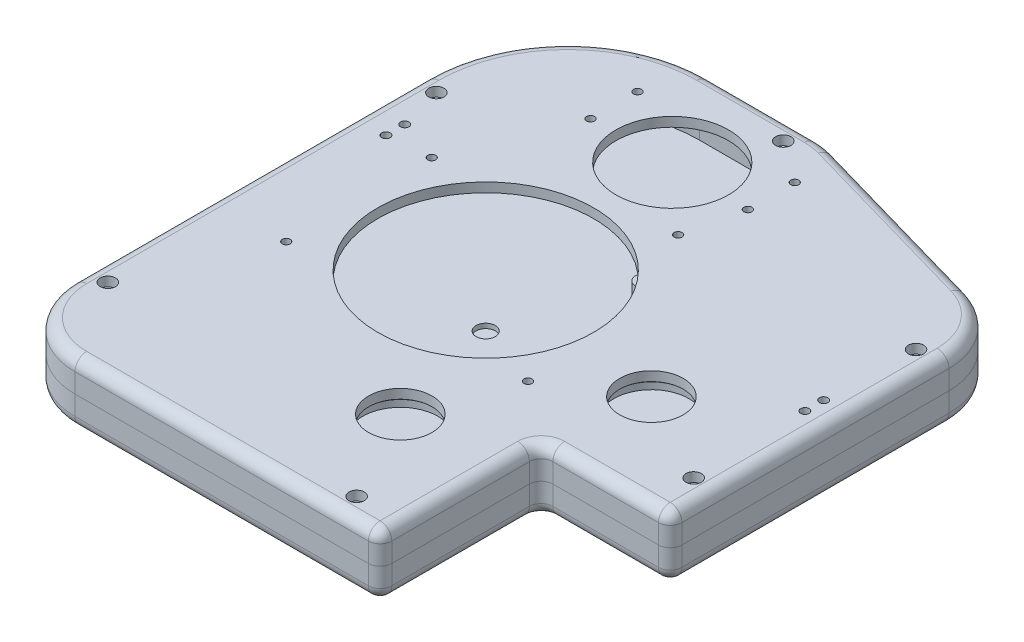
from build123d import *

# Parameters (mm, degrees)
BOSS_EXTRUDE1_DEPTH        = 26.5
FILLET2_R                  = 60
FILLET3_R                  = 30
FILLET4_R                  = 30
FILLET5_R                  = 30
FILLET9_R                  = 5
SHELL1_T                   = 4
FILLET6_R                  = 5
CUT_EXTRUDE1_REACH         = 267.334
SKETCH2_R                  = 46
SKETCH2_R_2                = 24
SKETCH3_R                  = 4.1
CUT_EXTRUDE2_DEPTH         = 2
SKETCH4_R                  = 4.25
CUT_EXTRUDE3_DEPTH         = 2
SKETCH9_R                  = 18.05
SKETCH9_R_2                = 14.5
BOSS_EXTRUDE5_DEPTH        = 0.8
SKETCH10_R                 = 18.05
SKETCH10_R_2               = 16.05
BOSS_EXTRUDE6_DEPTH        = 4
SKETCH11_R                 = 16.25
CUT_EXTRUDE4_DEPTH         = 2
CUT_EXTRUDE5_REACH         = 266.965
SKETCH13_R                 = 13.5
BRIDGE_HOLES_REACH         = 267.334
SKETCH14_R                 = 1.7
BOSS_EXTRUDE8_REACH        = 266.965
CUT_EXTRUDE7_DEPTH         = 266.334223198
CUT_EXTRUDE7_DEPTH_BACK    = 266.334223198
SKETCH16_R                 = 1.8
SKETCH18_R                 = 3.25
CUT_EXTRUDE9_DEPTH         = 4
SKETCH19_R                 = 3.8
SKETCH19_R_2               = 1.8
OUTPUT_TENSIONER_DEPTH     = 3
OUTPUT_TENSIONER_CUT_REACH = 266.965
SKETCH20_R                 = 1.8
SKETCH22_R                 = 3.8
SKETCH22_R_2               = 1.8
MOTOR_TENSIONER_DEPTH      = 9.25
SKETCH23_R                 = 1.8
MOTOR_TENSIONER_CUT_DEPTH  = 4
NUT_HOLES_DEPTH            = 2.2
CUT_EXTRUDE10_DEPTH        = 266.334223198
CUT_EXTRUDE10_DEPTH_BACK   = 266.334223198
SKETCH25_R                 = 1.8


with BuildPart() as part:
    # Sketch1 → Boss-Extrude1 (new body)
    with BuildSketch(Plane(origin=(0, 0, 0), x_dir=(1, 0, 0), z_dir=(0, 1, 0))):
        Polygon((0, 240), (-110, 240), (-110, 0), (0, 0), (50, 0), (50, 68.62), (105, 68.62), (105, 210), align=None)
    extrude(amount=BOSS_EXTRUDE1_DEPTH)

    # Fillet2
    fillet2_edges = [part.edges().sort_by_distance(p)[0] for p in [
        (-110, 13.25, -240),
    ]]
    fillet(fillet2_edges, radius=FILLET2_R)

    # Fillet3
    fillet3_edges = [part.edges().sort_by_distance(p)[0] for p in [
        (105, 13.25, -210),
    ]]
    fillet(fillet3_edges, radius=FILLET3_R)

    # Fillet4
    fillet4_edges = [part.edges().sort_by_distance(p)[0] for p in [
        (-110, 13.25, 0),
    ]]
    fillet(fillet4_edges, radius=FILLET4_R)

    # Fillet5
    fillet5_edges = [part.edges().sort_by_distance(p)[0] for p in [
        (0, 13.25, -240),
    ]]
    fillet(fillet5_edges, radius=FILLET5_R)

    # Fillet9
    fillet9_edges = [part.edges().sort_by_distance(p)[0] for p in [
        (105, 13.25, -68.62),
        (50, 13.25, -68.62),
        (50, 13.25, 0),
    ]]
    fillet(fillet9_edges, radius=FILLET9_R)

    # Shell1 (no face opened: a closed hollow body)
    add(offset(amount=-SHELL1_T, mode=Mode.PRIVATE), mode=Mode.SUBTRACT)

    # Fillet6
    fillet6_edges = [part.edges().sort_by_distance(p)[0] for p in [
        (-110, 0, -105),
        (-110, 26.5, -105),
        (-92.426406871, 0, -222.426406871),
        (-92.426406871, 26.5, -222.426406871),
        (43.640809667, 0, -227.531197238),
        (43.640809667, 26.5, -227.531197238),
        (98.950459443, 0, -205.436823012),
        (98.950459443, 26.5, -205.436823012),
        (-17.5, 0, 0),
        (-17.5, 26.5, 0),
        (-101.213203436, 0, -8.786796564),
        (-101.213203436, 26.5, -8.786796564),
        (-27.10082417, 0, -240),
        (-27.10082417, 26.5, -240),
        (-0.040611983, 0, -239.710028213),
        (-0.040611983, 26.5, -239.710028213),
        (50, 0, -34.31),
        (50, 26.5, -34.31),
        (105, 0, -130.495478809),
        (77.5, 0, -68.62),
        (103.535533906, 0, -70.084466094),
        (48.535533906, 0, -1.464466094),
        (77.5, 26.5, -68.62),
        (105, 26.5, -130.495478809),
        (103.535533906, 26.5, -70.084466094),
        (48.535533906, 26.5, -1.464466094),
        (51.464466094, 0, -67.155533906),
        (51.464466094, 26.5, -67.155533906),
    ]]
    fillet(fillet6_edges, radius=FILLET6_R)

    # Sketch2 → Cut-Extrude1 (cut, up to next)
    with BuildSketch(Plane(origin=(0, 26.5, 0), x_dir=(1, 0, 0), z_dir=(0, 1, 0)), mode=Mode.PRIVATE) as cut_extrude1_sk1:
        with Locations(Location((-25, 120, 0), (0, 0, 270))):
            Circle(SKETCH2_R)
    cut_extrude1_tool1 = extrude(cut_extrude1_sk1.sketch, amount=-CUT_EXTRUDE1_REACH, mode=Mode.PRIVATE) & part.part
    # Sketch2 → Cut-Extrude1 (cut, up to next)
    with BuildSketch(Plane(origin=(0, 26.5, 0), x_dir=(1, 0, 0), z_dir=(0, 1, 0)), mode=Mode.PRIVATE) as cut_extrude1_sk2:
        with Locations(Location((-25, 199.5, 0), (0, 0, 270))):
            Circle(SKETCH2_R_2)
    cut_extrude1_tool2 = extrude(cut_extrude1_sk2.sketch, amount=-CUT_EXTRUDE1_REACH, mode=Mode.PRIVATE) & part.part
    add(cut_extrude1_tool1.solids().sort_by_distance((-25, 26.5, -120))[0], mode=Mode.SUBTRACT)
    add(cut_extrude1_tool2.solids().sort_by_distance((-25, 26.5, -199.5))[0], mode=Mode.SUBTRACT)

    # Sketch3 → Cut-Extrude2 (cut)
    with BuildSketch(Plane(origin=(0, 4, 0), x_dir=(1, 0, 0), z_dir=(0, 1, 0))):
        with Locations(Location((-60, 48.62, 0), (0, 0, 270))):
            Circle(SKETCH3_R)
        with Locations(Location((41.22, 176.82, 0), (0, 0, 270))):
            Circle(SKETCH3_R)
        with Locations(Location((-25, 120, 0), (0, 0, 270))):
            Circle(SKETCH3_R)
        with Locations(Location((-25, 199.5, 0), (0, 0, 270))):
            Circle(SKETCH3_R)
    extrude(amount=-CUT_EXTRUDE2_DEPTH, mode=Mode.SUBTRACT)

    # Sketch4 → Cut-Extrude3 (cut)
    with BuildSketch(Plane.XZ.offset(-22.5)):
        with Locations(Location((-60, -48.62, 0), (0, 0, 270))):
            Circle(SKETCH4_R)
        with Locations(Location((41.22, -176.82, 0), (0, 0, 270))):
            Circle(SKETCH4_R)
    extrude(amount=-CUT_EXTRUDE3_DEPTH, mode=Mode.SUBTRACT)

    # Sketch9 → Boss-Extrude5 (add)
    # profile 1 of 2: a face of its own
    with BuildSketch(Plane.XZ.offset(-22.5)):
        with Locations(Location((57, -108.62, 0), (0, 0, 90))):
            Circle(SKETCH9_R)
        with Locations(Location((57, -108.62, 0), (0, 0, 270))):
            Circle(SKETCH9_R_2, mode=Mode.SUBTRACT)
    # profile 2 of 2: a face of its own
    with BuildSketch(Plane.XZ.offset(-22.5)):
        with Locations(Location((10, -48.62, 0), (0, 0, 90))):
            Circle(SKETCH9_R)
        with Locations(Location((10, -48.62, 0), (0, 0, 270))):
            Circle(SKETCH9_R_2, mode=Mode.SUBTRACT)
    extrude(amount=BOSS_EXTRUDE5_DEPTH)

    # Sketch10 → Boss-Extrude6 (add)
    # profile 1 of 2: a face of its own
    with BuildSketch(Plane.XZ.offset(-21.7)):
        with Locations(Location((10, -48.62, 0), (0, 0, 90))):
            Circle(SKETCH10_R)
        with Locations(Location((10, -48.62, 0), (0, 0, 270))):
            Circle(SKETCH10_R_2, mode=Mode.SUBTRACT)
    # profile 2 of 2: a face of its own
    with BuildSketch(Plane.XZ.offset(-21.7)):
        with Locations(Location((57, -108.62, 0), (0, 0, 90))):
            Circle(SKETCH10_R)
        with Locations(Location((57, -108.62, 0), (0, 0, 270))):
            Circle(SKETCH10_R_2, mode=Mode.SUBTRACT)
    extrude(amount=BOSS_EXTRUDE6_DEPTH)

    # Sketch11 → Cut-Extrude4 (cut)
    with BuildSketch(Plane(origin=(0, 4, 0), x_dir=(1, 0, 0), z_dir=(0, 1, 0))):
        with Locations(Location((10, 48.62, 0), (0, 0, 270))):
            Circle(SKETCH11_R)
        with Locations(Location((57, 108.62, 0), (0, 0, 270))):
            Circle(SKETCH11_R)
    extrude(amount=-CUT_EXTRUDE4_DEPTH, mode=Mode.SUBTRACT)

    # Sketch13 → Cut-Extrude5 (cut, up to next)
    with BuildSketch(Plane.XZ.offset(-22.5), mode=Mode.PRIVATE) as cut_extrude5_sk1:
        with Locations(Location((57, -108.62, 0), (0, 0, 270))):
            Circle(SKETCH13_R)
    cut_extrude5_tool1 = extrude(cut_extrude5_sk1.sketch, amount=-CUT_EXTRUDE5_REACH, mode=Mode.PRIVATE) & part.part
    # Sketch13 → Cut-Extrude5 (cut, up to next)
    with BuildSketch(Plane.XZ.offset(-22.5), mode=Mode.PRIVATE) as cut_extrude5_sk2:
        with Locations(Location((10, -48.62, 0), (0, 0, 270))):
            Circle(SKETCH13_R)
    cut_extrude5_tool2 = extrude(cut_extrude5_sk2.sketch, amount=-CUT_EXTRUDE5_REACH, mode=Mode.PRIVATE) & part.part
    add(cut_extrude5_tool1.solids().sort_by_distance((57, 22.5, -108.62))[0], mode=Mode.SUBTRACT)
    add(cut_extrude5_tool2.solids().sort_by_distance((10, 22.5, -48.62))[0], mode=Mode.SUBTRACT)

    # Sketch14 → Bridge Holes (cut, up to next)
    with BuildSketch(Plane(origin=(0, 26.5, 0), x_dir=(1, 0, 0), z_dir=(0, 1, 0)), mode=Mode.PRIVATE) as bridge_holes_sk1:
        with Locations(Location((-58.5, 218.19, 0), (0, 0, 270))):
            Circle(SKETCH14_R)
    bridge_holes_tool1 = extrude(bridge_holes_sk1.sketch, amount=-BRIDGE_HOLES_REACH, mode=Mode.PRIVATE) & part.part
    # Sketch14 → Bridge Holes (cut, up to next)
    with BuildSketch(Plane(origin=(0, 26.5, 0), x_dir=(1, 0, 0), z_dir=(0, 1, 0)), mode=Mode.PRIVATE) as bridge_holes_sk2:
        with Locations(Location((-58.5, 198.19, 0), (0, 0, 270))):
            Circle(SKETCH14_R)
    bridge_holes_tool2 = extrude(bridge_holes_sk2.sketch, amount=-BRIDGE_HOLES_REACH, mode=Mode.PRIVATE) & part.part
    # Sketch14 → Bridge Holes (cut, up to next)
    with BuildSketch(Plane(origin=(0, 26.5, 0), x_dir=(1, 0, 0), z_dir=(0, 1, 0)), mode=Mode.PRIVATE) as bridge_holes_sk3:
        with Locations(Location((8.5, 218.19, 0), (0, 0, 270))):
            Circle(SKETCH14_R)
    bridge_holes_tool3 = extrude(bridge_holes_sk3.sketch, amount=-BRIDGE_HOLES_REACH, mode=Mode.PRIVATE) & part.part
    # Sketch14 → Bridge Holes (cut, up to next)
    with BuildSketch(Plane(origin=(0, 26.5, 0), x_dir=(1, 0, 0), z_dir=(0, 1, 0)), mode=Mode.PRIVATE) as bridge_holes_sk4:
        with Locations(Location((8.5, 198.19, 0), (0, 0, 270))):
            Circle(SKETCH14_R)
    bridge_holes_tool4 = extrude(bridge_holes_sk4.sketch, amount=-BRIDGE_HOLES_REACH, mode=Mode.PRIVATE) & part.part
    # Sketch14 → Bridge Holes (cut, up to next)
    with BuildSketch(Plane(origin=(0, 26.5, 0), x_dir=(1, 0, 0), z_dir=(0, 1, 0)), mode=Mode.PRIVATE) as bridge_holes_sk5:
        with Locations(Location((-78, 150, 0), (0, 0, 270))):
            Circle(SKETCH14_R)
    bridge_holes_tool5 = extrude(bridge_holes_sk5.sketch, amount=-BRIDGE_HOLES_REACH, mode=Mode.PRIVATE) & part.part
    # Sketch14 → Bridge Holes (cut, up to next)
    with BuildSketch(Plane(origin=(0, 26.5, 0), x_dir=(1, 0, 0), z_dir=(0, 1, 0)), mode=Mode.PRIVATE) as bridge_holes_sk6:
        with Locations(Location((-78, 88, 0), (0, 0, 270))):
            Circle(SKETCH14_R)
    bridge_holes_tool6 = extrude(bridge_holes_sk6.sketch, amount=-BRIDGE_HOLES_REACH, mode=Mode.PRIVATE) & part.part
    # Sketch14 → Bridge Holes (cut, up to next)
    with BuildSketch(Plane(origin=(0, 26.5, 0), x_dir=(1, 0, 0), z_dir=(0, 1, 0)), mode=Mode.PRIVATE) as bridge_holes_sk7:
        with Locations(Location((3, 174, 0), (0, 0, 270))):
            Circle(SKETCH14_R)
    bridge_holes_tool7 = extrude(bridge_holes_sk7.sketch, amount=-BRIDGE_HOLES_REACH, mode=Mode.PRIVATE) & part.part
    # Sketch14 → Bridge Holes (cut, up to next)
    with BuildSketch(Plane(origin=(0, 26.5, 0), x_dir=(1, 0, 0), z_dir=(0, 1, 0)), mode=Mode.PRIVATE) as bridge_holes_sk8:
        with Locations(Location((25, 88, 0), (0, 0, 270))):
            Circle(SKETCH14_R)
    bridge_holes_tool8 = extrude(bridge_holes_sk8.sketch, amount=-BRIDGE_HOLES_REACH, mode=Mode.PRIVATE) & part.part
    add(bridge_holes_tool1.solids().sort_by_distance((-58.5, 26.5, -218.19))[0], mode=Mode.SUBTRACT)
    add(bridge_holes_tool2.solids().sort_by_distance((-58.5, 26.5, -198.19))[0], mode=Mode.SUBTRACT)
    add(bridge_holes_tool3.solids().sort_by_distance((8.5, 26.5, -218.19))[0], mode=Mode.SUBTRACT)
    add(bridge_holes_tool4.solids().sort_by_distance((8.5, 26.5, -198.19))[0], mode=Mode.SUBTRACT)
    add(bridge_holes_tool5.solids().sort_by_distance((-78, 26.5, -150))[0], mode=Mode.SUBTRACT)
    add(bridge_holes_tool6.solids().sort_by_distance((-78, 26.5, -88))[0], mode=Mode.SUBTRACT)
    add(bridge_holes_tool7.solids().sort_by_distance((3, 26.5, -174))[0], mode=Mode.SUBTRACT)
    add(bridge_holes_tool8.solids().sort_by_distance((25, 26.5, -88))[0], mode=Mode.SUBTRACT)

    # Sketch15 → Boss-Extrude8 (add, up to next)
    with BuildSketch(Plane(origin=(0, 4, 0), x_dir=(1, 0, 0), z_dir=(0, 1, 0)), mode=Mode.PRIVATE) as boss_extrude8_sk1:
        with BuildLine():
            Line((-106, 30), (-101, 30))
            ThreePointArc((-101, 30), (-96, 35), (-101, 40))
            Line((-101, 40), (-106, 40))
            Line((-106, 40), (-106, 30))
        make_face()
    boss_extrude8_tool1 = extrude(boss_extrude8_sk1.sketch, amount=BOSS_EXTRUDE8_REACH, mode=Mode.PRIVATE) - part.part
    # Sketch15 → Boss-Extrude8 (add, up to next)
    with BuildSketch(Plane(origin=(0, 4, 0), x_dir=(1, 0, 0), z_dir=(0, 1, 0)), mode=Mode.PRIVATE) as boss_extrude8_sk2:
        with BuildLine():
            Line((-106, 180), (-101, 180))
            ThreePointArc((-101, 180), (-96, 175), (-101, 170))
            Line((-101, 170), (-106, 170))
            Line((-106, 170), (-106, 180))
        make_face()
    boss_extrude8_tool2 = extrude(boss_extrude8_sk2.sketch, amount=BOSS_EXTRUDE8_REACH, mode=Mode.PRIVATE) - part.part
    # Sketch15 → Boss-Extrude8 (add, up to next)
    with BuildSketch(Plane(origin=(0, 4, 0), x_dir=(1, 0, 0), z_dir=(0, 1, 0)), mode=Mode.PRIVATE) as boss_extrude8_sk3:
        with BuildLine():
            Line((-4.201648339, 236), (-14.201648339, 236))
            Line((-14.201648339, 236), (-14.201648339, 231))
            ThreePointArc((-14.201648339, 231), (-9.201648339, 226), (-4.201648339, 231))
            Line((-4.201648339, 231), (-4.201648339, 236))
        make_face()
    boss_extrude8_tool3 = extrude(boss_extrude8_sk3.sketch, amount=BOSS_EXTRUDE8_REACH, mode=Mode.PRIVATE) - part.part
    # Sketch15 → Boss-Extrude8 (add, up to next)
    with BuildSketch(Plane(origin=(0, 4, 0), x_dir=(1, 0, 0), z_dir=(0, 1, 0)), mode=Mode.PRIVATE) as boss_extrude8_sk4:
        with BuildLine():
            Line((101, 187.370957617), (96, 187.370957617))
            ThreePointArc((96, 187.370957617), (91, 182.370957617), (96, 177.370957617))
            Line((96, 177.370957617), (101, 177.370957617))
            Line((101, 177.370957617), (101, 187.370957617))
        make_face()
    boss_extrude8_tool4 = extrude(boss_extrude8_sk4.sketch, amount=BOSS_EXTRUDE8_REACH, mode=Mode.PRIVATE) - part.part
    # Sketch15 → Boss-Extrude8 (add, up to next)
    with BuildSketch(Plane(origin=(0, 4, 0), x_dir=(1, 0, 0), z_dir=(0, 1, 0)), mode=Mode.PRIVATE) as boss_extrude8_sk5:
        with BuildLine():
            Line((101, 82.62), (96, 82.62))
            ThreePointArc((96, 82.62), (91, 87.62), (96, 92.62))
            Line((96, 92.62), (101, 92.62))
            Line((101, 92.62), (101, 82.62))
        make_face()
    boss_extrude8_tool5 = extrude(boss_extrude8_sk5.sketch, amount=BOSS_EXTRUDE8_REACH, mode=Mode.PRIVATE) - part.part
    # Sketch15 → Boss-Extrude8 (add, up to next)
    with BuildSketch(Plane(origin=(0, 4, 0), x_dir=(1, 0, 0), z_dir=(0, 1, 0)), mode=Mode.PRIVATE) as boss_extrude8_sk6:
        with BuildLine():
            Line((36, 4), (26, 4))
            Line((26, 4), (26, 9))
            ThreePointArc((26, 9), (31, 14), (36, 9))
            Line((36, 9), (36, 4))
        make_face()
    boss_extrude8_tool6 = extrude(boss_extrude8_sk6.sketch, amount=BOSS_EXTRUDE8_REACH, mode=Mode.PRIVATE) - part.part
    add(boss_extrude8_tool1.solids().sort_by_distance((-101.466749, 4, -35))[0])
    add(boss_extrude8_tool2.solids().sort_by_distance((-101.466749, 4, -175))[0])
    add(boss_extrude8_tool3.solids().sort_by_distance((-9.201648, 4, -231.466749))[0])
    add(boss_extrude8_tool4.solids().sort_by_distance((96.466749, 4, -182.370958))[0])
    add(boss_extrude8_tool5.solids().sort_by_distance((96.466749, 4, -87.62))[0])
    add(boss_extrude8_tool6.solids().sort_by_distance((31, 4, -8.533251))[0])

    # Sketch16 → Cut-Extrude7 (cut, two sides: drawn at the far end of the back side and taken through both)
    with BuildSketch(Plane(origin=(0, 26.5, 0), x_dir=(1, 0, 0), z_dir=(0, 1, 0)).offset(-CUT_EXTRUDE7_DEPTH_BACK)):
        with Locations(Location((-101, 35, 0), (0, 0, 270))):
            Circle(SKETCH16_R)
        with Locations(Location((-101, 175, 0), (0, 0, 270))):
            Circle(SKETCH16_R)
        with Locations(Location((-9.201648339, 231, 0), (0, 0, 270))):
            Circle(SKETCH16_R)
        with Locations(Location((96, 182.370957617, 0), (0, 0, 270))):
            Circle(SKETCH16_R)
        with Locations(Location((96, 87.62, 0), (0, 0, 270))):
            Circle(SKETCH16_R)
        with Locations(Location((31, 9, 0), (0, 0, 270))):
            Circle(SKETCH16_R)
    extrude(amount=CUT_EXTRUDE7_DEPTH + CUT_EXTRUDE7_DEPTH_BACK, mode=Mode.SUBTRACT)

    # Sketch18 → Cut-Extrude9 (cut)
    with BuildSketch(Plane(origin=(0, 26.5, 0), x_dir=(1, 0, 0), z_dir=(0, 1, 0))):
        with Locations(Location((96, 182.370957617, 0), (0, 0, 270))):
            Circle(SKETCH18_R)
        with Locations(Location((96, 87.62, 0), (0, 0, 270))):
            Circle(SKETCH18_R)
        with Locations(Location((31, 9, 0), (0, 0, 270))):
            Circle(SKETCH18_R)
        with Locations(Location((-101, 35, 0), (0, 0, 270))):
            Circle(SKETCH18_R)
        with Locations(Location((-101, 175, 0), (0, 0, 270))):
            Circle(SKETCH18_R)
        with Locations(Location((-9.201648339, 231, 0), (0, 0, 270))):
            Circle(SKETCH18_R)
    extrude(amount=-CUT_EXTRUDE9_DEPTH, mode=Mode.SUBTRACT)

    # Sketch19 → Output Tensioner (add)
    # profile 1 of 4: a face of its own
    with BuildSketch(Plane(origin=(0, 4, 0), x_dir=(1, 0, 0), z_dir=(0, 1, 0))):
        with Locations(Location((74.440986501, 148.580130003, 0), (0, 0, 270))):
            Circle(SKETCH19_R)
        with Locations(Location((74.440986501, 148.580130003, 0), (0, 0, 270))):
            Circle(SKETCH19_R_2, mode=Mode.SUBTRACT)
    # profile 2 of 4: a face of its own
    with BuildSketch(Plane(origin=(0, 4, 0), x_dir=(1, 0, 0), z_dir=(0, 1, 0))):
        with Locations(Location((23.779413458, 136.858141401, 0), (0, 0, 270))):
            Circle(SKETCH19_R)
        with Locations(Location((23.779413458, 136.858141401, 0), (0, 0, 270))):
            Circle(SKETCH19_R_2, mode=Mode.SUBTRACT)
    # profile 3 of 4: a face of its own
    with BuildSketch(Plane(origin=(0, 4, 0), x_dir=(1, 0, 0), z_dir=(0, 1, 0))):
        with Locations(Location((-25, 74.62, 0), (0, 0, 270))):
            Circle(SKETCH19_R)
        with Locations(Location((-25, 74.62, 0), (0, 0, 270))):
            Circle(SKETCH19_R_2, mode=Mode.SUBTRACT)
    # profile 4 of 4: a face of its own
    with BuildSketch(Plane(origin=(0, 4, 0), x_dir=(1, 0, 0), z_dir=(0, 1, 0))):
        with Locations(Location((-25, 22.62, 0), (0, 0, 270))):
            Circle(SKETCH19_R)
        with Locations(Location((-25, 22.62, 0), (0, 0, 270))):
            Circle(SKETCH19_R_2, mode=Mode.SUBTRACT)
    extrude(amount=OUTPUT_TENSIONER_DEPTH)

    # Sketch20 → Output Tensioner Cut (cut, up to next)
    with BuildSketch(Plane(origin=(0, 4, 0), x_dir=(1, 0, 0), z_dir=(0, 1, 0)), mode=Mode.PRIVATE) as output_tensioner_cut_sk1:
        with Locations(Location((74.440986501, 148.580130003, 0), (0, 0, 270))):
            Circle(SKETCH20_R)
    output_tensioner_cut_tool1 = extrude(output_tensioner_cut_sk1.sketch, amount=-OUTPUT_TENSIONER_CUT_REACH, mode=Mode.PRIVATE) & part.part
    # Sketch20 → Output Tensioner Cut (cut, up to next)
    with BuildSketch(Plane(origin=(0, 4, 0), x_dir=(1, 0, 0), z_dir=(0, 1, 0)), mode=Mode.PRIVATE) as output_tensioner_cut_sk2:
        with Locations(Location((23.779413458, 136.858141401, 0), (0, 0, 270))):
            Circle(SKETCH20_R)
    output_tensioner_cut_tool2 = extrude(output_tensioner_cut_sk2.sketch, amount=-OUTPUT_TENSIONER_CUT_REACH, mode=Mode.PRIVATE) & part.part
    # Sketch20 → Output Tensioner Cut (cut, up to next)
    with BuildSketch(Plane(origin=(0, 4, 0), x_dir=(1, 0, 0), z_dir=(0, 1, 0)), mode=Mode.PRIVATE) as output_tensioner_cut_sk3:
        with Locations(Location((-25, 22.62, 0), (0, 0, 270))):
            Circle(SKETCH20_R)
    output_tensioner_cut_tool3 = extrude(output_tensioner_cut_sk3.sketch, amount=-OUTPUT_TENSIONER_CUT_REACH, mode=Mode.PRIVATE) & part.part
    # Sketch20 → Output Tensioner Cut (cut, up to next)
    with BuildSketch(Plane(origin=(0, 4, 0), x_dir=(1, 0, 0), z_dir=(0, 1, 0)), mode=Mode.PRIVATE) as output_tensioner_cut_sk4:
        with Locations(Location((-25, 74.62, 0), (0, 0, 270))):
            Circle(SKETCH20_R)
    output_tensioner_cut_tool4 = extrude(output_tensioner_cut_sk4.sketch, amount=-OUTPUT_TENSIONER_CUT_REACH, mode=Mode.PRIVATE) & part.part
    add(output_tensioner_cut_tool1.solids().sort_by_distance((74.440987, 4, -148.58013))[0], mode=Mode.SUBTRACT)
    add(output_tensioner_cut_tool2.solids().sort_by_distance((23.779413, 4, -136.858141))[0], mode=Mode.SUBTRACT)
    add(output_tensioner_cut_tool3.solids().sort_by_distance((-25, 4, -22.62))[0], mode=Mode.SUBTRACT)
    add(output_tensioner_cut_tool4.solids().sort_by_distance((-25, 4, -74.62))[0], mode=Mode.SUBTRACT)


with BuildPart() as body_2:
    # Split No Tensioners: the piece on the far side of the plane
    add(part.part)
    split(bisect_by=Plane.ZX.offset(13.25), keep=Keep.BOTTOM)

    # Sketch22 → Motor Tensioner (add)
    # profile 1 of 4: a face of its own
    with BuildSketch(Plane(origin=(0, 4, 0), x_dir=(1, 0, 0), z_dir=(0, 1, 0))):
        with Locations(Location((16.694675597, 213.230966245, 0), (0, 0, 270))):
            Circle(SKETCH22_R)
        with Locations(Location((16.694675597, 213.230966245, 0), (0, 0, 270))):
            Circle(SKETCH22_R_2, mode=Mode.SUBTRACT)
    # profile 2 of 4: a face of its own
    with BuildSketch(Plane(origin=(0, 4, 0), x_dir=(1, 0, 0), z_dir=(0, 1, 0))):
        with Locations(Location((-0.478251766, 163.090258574, 0), (0, 0, 270))):
            Circle(SKETCH22_R)
        with Locations(Location((-0.478251766, 163.090258574, 0), (0, 0, 270))):
            Circle(SKETCH22_R_2, mode=Mode.SUBTRACT)
    # profile 3 of 4: a face of its own
    with BuildSketch(Plane(origin=(0, 4, 0), x_dir=(1, 0, 0), z_dir=(0, 1, 0))):
        with Locations(Location((-68.384624881, 91.712320262, 0), (0, 0, 270))):
            Circle(SKETCH22_R)
        with Locations(Location((-68.384624881, 91.712320262, 0), (0, 0, 270))):
            Circle(SKETCH22_R_2, mode=Mode.SUBTRACT)
    # profile 4 of 4: a face of its own
    with BuildSketch(Plane(origin=(0, 4, 0), x_dir=(1, 0, 0), z_dir=(0, 1, 0))):
        with Locations(Location((-17.353471036, 85.623696671, 0), (0, 0, 270))):
            Circle(SKETCH22_R)
        with Locations(Location((-17.353471036, 85.623696671, 0), (0, 0, 270))):
            Circle(SKETCH22_R_2, mode=Mode.SUBTRACT)
    extrude(amount=MOTOR_TENSIONER_DEPTH)

    # Sketch23 → Motor Tensioner Cut (cut)
    with BuildSketch(Plane(origin=(0, 4, 0), x_dir=(1, 0, 0), z_dir=(0, 1, 0))):
        with Locations(Location((-0.478251766, 163.090258574, 0), (0, 0, 270))):
            Circle(SKETCH23_R)
        with Locations(Location((16.694675597, 213.230966245, 0), (0, 0, 270))):
            Circle(SKETCH23_R)
        with Locations(Location((-68.384624881, 91.712320262, 0), (0, 0, 270))):
            Circle(SKETCH23_R)
        with Locations(Location((-17.353471036, 85.623696671, 0), (0, 0, 270))):
            Circle(SKETCH23_R)
    extrude(amount=-MOTOR_TENSIONER_CUT_DEPTH, mode=Mode.SUBTRACT)

    # Sketch24 → Nut Holes (cut)
    with BuildSketch(Plane.XZ):
        Polygon((-97.9, -33.210214166), (-101, -31.420428331), (-104.1, -33.210214166), (-104.1, -36.789785834), (-101, -38.579571669), (-97.9, -36.789785834), align=None)
        Polygon((34.1, -7.210214166), (31, -5.420428331), (27.9, -7.210214166), (27.9, -10.789785834), (31, -12.579571669), (34.1, -10.789785834), align=None)
        Polygon((99.1, -85.830214166), (96, -84.040428331), (92.9, -85.830214166), (92.9, -89.409785834), (96, -91.199571669), (99.1, -89.409785834), align=None)
        Polygon((99.1, -180.581171783), (96, -178.791385948), (92.9, -180.581171783), (92.9, -184.160743452), (96, -185.950529286), (99.1, -184.160743452), align=None)
        Polygon((-6.101648339, -232.789785834), (-6.101648339, -229.210214166), (-9.201648339, -227.420428331), (-12.301648339, -229.210214166), (-12.301648339, -232.789785834), (-9.201648339, -234.579571669), align=None)
        Polygon((-97.9, -173.210214166), (-101, -171.420428331), (-104.1, -173.210214166), (-104.1, -176.789785834), (-101, -178.579571669), (-97.9, -176.789785834), align=None)
    extrude(amount=-NUT_HOLES_DEPTH, mode=Mode.SUBTRACT)


with BuildPart() as part_1:
    add(part.part)

    # Split No Tensioners
    split(bisect_by=Plane.ZX.offset(13.25), keep=Keep.TOP)


with BuildPart() as body_2_1:
    add(body_2.part)

    # Combine1: read off the stored shape, not the designer's step
    # Combine1: union part
    add(part_1.part)

    # Sketch25 → Cut-Extrude10 (cut, two sides: drawn at the far end of the back side and taken through both)
    with BuildSketch(Plane(origin=(0, 26.5, 0), x_dir=(1, 0, 0), z_dir=(0, 1, 0)).offset(-CUT_EXTRUDE10_DEPTH_BACK)):
        with Locations(Location((95, 144.000957617, 0), (0, 0, 270))):
            Circle(SKETCH25_R)
        with Locations(Location((95, 136.000957617, 0), (0, 0, 270))):
            Circle(SKETCH25_R)
        with Locations(Location((-96, 156.5, 0), (0, 0, 270))):
            Circle(SKETCH25_R)
        with Locations(Location((-96, 148.5, 0), (0, 0, 270))):
            Circle(SKETCH25_R)
    extrude(amount=CUT_EXTRUDE10_DEPTH + CUT_EXTRUDE10_DEPTH_BACK, mode=Mode.SUBTRACT)


with BuildPart() as body_2_2:
    # Split With Tensioners: the piece on the far side of the plane
    add(body_2_1.part)
    split(bisect_by=Plane.ZX.offset(13.25), keep=Keep.BOTTOM)


with BuildPart() as body_2_3:
    add(body_2_1.part)

    # Split With Tensioners
    split(bisect_by=Plane.ZX.offset(13.25), keep=Keep.TOP)


solid = Compound([body_2_2.part, body_2_3.part])
